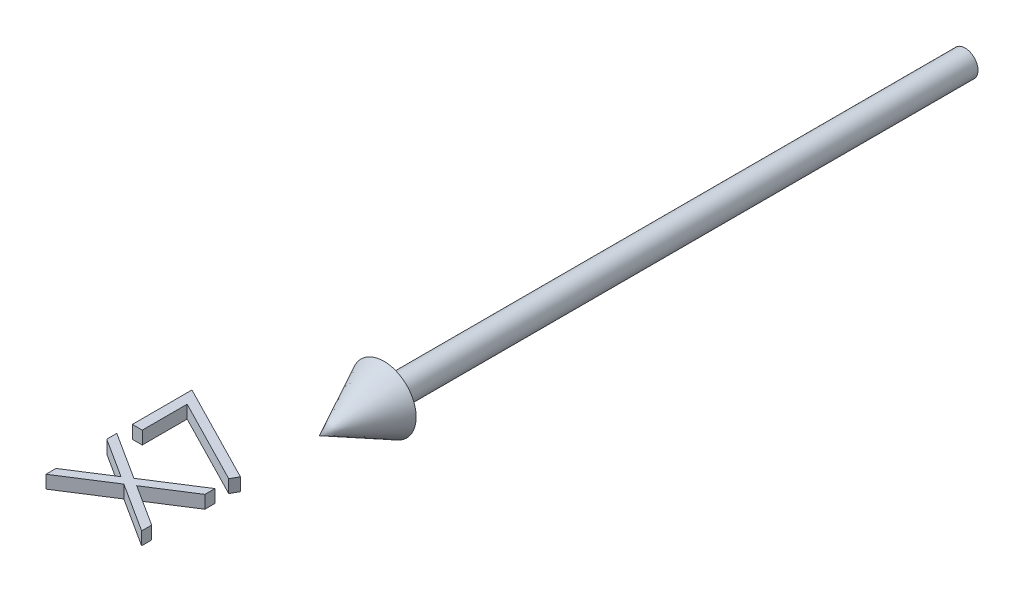
from build123d import *

# Parameters (mm, degrees)
BOSS_EXTRUDE1_DEPTH        = 1
BOSS_EXTRUDE1_DEPTH_BACK   = 1
BOSS_EXTRUDE1_2_DEPTH      = 1
BOSS_EXTRUDE1_2_DEPTH_BACK = 1


with BuildPart() as part:
    # Sketch2 → Revolve1 (revolve)
    with BuildSketch(Plane(origin=(0, 0, 0), x_dir=(1, 0, 0), z_dir=(0, 1, 0))):
        Polygon((0, -100), (5, -90), (2, -90), (2, 0), (0, 0), align=None)
    revolve(axis=Axis((0, 0, -41.949952025), (0, 0, 1)))


with BuildPart() as body_2:
    # Sketch3 → Boss-Extrude1 (new, two sides: drawn at the far end of the back side and taken through both)
    with BuildSketch(Plane(origin=(0, 0, 0), x_dir=(1, 0, 0), z_dir=(0, 1, 0)).offset(-BOSS_EXTRUDE1_DEPTH_BACK)):
        Polygon((-15, -113.952803959), (-15, -104.722034728), (0.384615385, -112.606650112), (-0.255408654, -113.769510689), (-13.461538462, -106.999678959), (-13.461538462, -113.952803959), align=None)
    extrude(amount=BOSS_EXTRUDE1_DEPTH + BOSS_EXTRUDE1_DEPTH_BACK)


with BuildPart() as body_3:
    # Sketch3 → Boss-Extrude1 2 (new, two sides: drawn at the far end of the back side and taken through both)
    with BuildSketch(Plane(origin=(0, 0, 0), x_dir=(1, 0, 0), z_dir=(0, 1, 0)).offset(-BOSS_EXTRUDE1_2_DEPTH_BACK)):
        Polygon((-15, -127.318188574), (-15, -125.764702997), (-8.864182692, -121.837419343), (-15, -117.910135689), (-15, -116.356650112), (-7.650240385, -121.059174151), (0, -116.16434242), (0, -117.717827997), (-6.436298077, -121.837419343), (0, -125.957010689), (0, -127.510496266), (-7.650240385, -122.612659728), align=None)
    extrude(amount=BOSS_EXTRUDE1_2_DEPTH + BOSS_EXTRUDE1_2_DEPTH_BACK)


solid = Compound([part.part, body_2.part, body_3.part])
